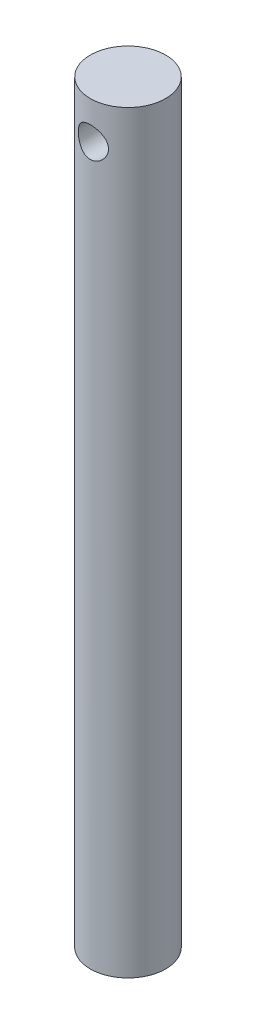
from build123d import *

# Parameters (mm, degrees)
SKETCH1_R               = 15
BOSS_EXTRUDE1_DEPTH     = 300
CUT_EXTRUDE1_DEPTH      = 301.749064836
CUT_EXTRUDE1_DEPTH_BACK = 301.749064836
SKETCH2_R               = 6


with BuildPart() as part:
    # Sketch1 → Boss-Extrude1 (new body)
    with BuildSketch(Plane(origin=(0, 0, 0), x_dir=(1, 0, 0), z_dir=(0, 1, 0))):
        Circle(SKETCH1_R)
    extrude(amount=BOSS_EXTRUDE1_DEPTH)

    # Sketch2 → Cut-Extrude1 (cut, two sides: drawn at the far end of the back side and taken through both)
    with BuildSketch(Plane.XY.offset(-CUT_EXTRUDE1_DEPTH_BACK)):
        with Locations((0, 285)):
            Circle(SKETCH2_R)
    extrude(amount=CUT_EXTRUDE1_DEPTH + CUT_EXTRUDE1_DEPTH_BACK, mode=Mode.SUBTRACT)


solid = part.part
